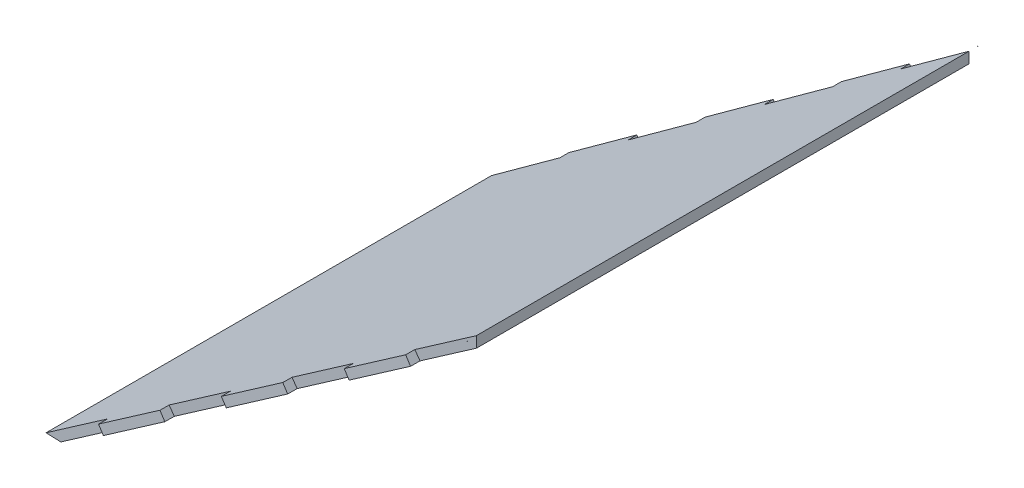
from build123d import *

# Parameters (mm, degrees)
CUT_EXTRUDE1_DEPTH = 878.515019104


with BuildPart() as part:
    # Boss-Extrude1: read off the stored shape, not the designer's step
    # Boss-Extrude1: loft between two sections, ruled curve by curve
    boss_extrude1_from = [
        Edge.make_line((-1299.235479685, 1493.906364056, 291.041413739), (-1816.691112906, 1125.851113248, 264.08415862)),
        Edge.make_line((-1816.691112906, 1125.851113248, 264.08415862), (-1816.691112906, 1125.851113248, -264.08415862)),
        Edge.make_line((-1299.235479685, 1493.906364056, 291.041413739), (-1299.235479685, 1493.906364056, -291.041413739)),
        Edge.make_line((-1299.235479685, 1493.906364056, -291.041413739), (-1816.691112906, 1125.851113248, -264.08415862)),
    ]
    boss_extrude1_to = [
        Edge.make_line((-1299.235479685, 1481.438435241, 291.041413739), (-1799.16222292, 1125.851113248, 264.997339826)),
        Edge.make_line((-1799.16222292, 1125.851113248, 264.997339826), (-1799.16222292, 1125.851113248, -264.997339826)),
        Edge.make_line((-1299.235479685, 1481.438435241, 291.041413739), (-1299.235479685, 1481.438435241, -291.041413739)),
        Edge.make_line((-1299.235479685, 1481.438435241, -291.041413739), (-1799.16222292, 1125.851113248, -264.997339826)),
    ]
    boss_extrude1 = Solid(Shell([*[Face.make_surface_from_curves(boss_extrude1_from[k], boss_extrude1_to[k]) for k in range(4)], Face(Wire(boss_extrude1_from)), Face(Wire(boss_extrude1_to))]))
    add(boss_extrude1)

    # Sketch2 → Cut-Extrude1 (cut, through all)
    with BuildSketch(Plane(origin=(-1142.087792172, 1605.682191448, 0), x_dir=(0.81489076097809, 0.5796145682024818, 0), z_dir=(-0.5796145682024818, 0.81489076097809, 0))):
        Polygon((-827.845096593, -264.08415862), (-827.414168646, -253.933301459), (-827.845096593, -253.915007546), align=None)
        Polygon((-737.192372014, -267.932581649), (-736.761444067, -257.781724488), (-827.414168646, -253.933301459), (-827.845096593, -264.08415862), align=None)
        Polygon((-555.886922855, -275.629427708), (-555.455994909, -265.478570547), (-646.108719488, -261.630147518), (-646.539647434, -271.781004679), align=None)
        Polygon((-374.581473697, -283.326273767), (-374.150545751, -273.175416606), (-464.80327033, -269.326993577), (-465.234198276, -279.477850738), align=None)
        Polygon((-193.276024539, -291.023119826), (-192.845096593, -280.872262665), (-283.497821172, -277.023839636), (-283.928749118, -287.174696797), align=None)
        Polygon((-192.845096593, -291.041413739), (-192.845096593, -280.872262665), (-193.276024539, -291.023119826), align=None)
        Polygon((-192.845096593, 280.872262665), (-193.276024539, 291.023119826), (-283.928749118, 287.174696797), (-283.497821172, 277.023839636), align=None)
        Polygon((-192.845096593, 280.872262665), (-192.845096593, 291.041413739), (-193.276024539, 291.023119826), align=None)
        Polygon((-374.150545751, 273.175416606), (-374.581473697, 283.326273767), (-465.234198276, 279.477850738), (-464.80327033, 269.326993577), align=None)
        Polygon((-555.455994909, 265.478570547), (-555.886922855, 275.629427708), (-646.539647434, 271.781004679), (-646.108719488, 261.630147518), align=None)
        Polygon((-736.761444067, 257.781724488), (-737.192372014, 267.932581649), (-827.845096593, 264.08415862), (-827.414168646, 253.933301459), align=None)
        Polygon((-827.414168646, 253.933301459), (-827.845096593, 264.08415862), (-827.845096593, 253.917668219), align=None)
        Polygon((-556.826174341, -297.75425795), (-555.886922855, -275.629427708), (-646.539647434, -271.781004679), (-647.47889892, -293.90583492), align=None)
        Polygon((-375.262063911, -299.358128032), (-374.581473697, -283.326273767), (-465.234198276, -279.477850738), (-465.91478849, -295.509705003), align=None)
        Polygon((-194.006069754, -308.219926744), (-193.276024539, -291.023119826), (-283.928749118, -287.174696797), (-284.658794333, -304.371503715), align=None)
        Polygon((-738.000757054, -286.974746688), (-737.192372014, -267.932581649), (-827.845096593, -264.08415862), (-828.653481633, -283.126323658), align=None)
        Polygon((-827.845096593, 264.08415862), (-737.192372014, 267.932581649), (-737.748395542, 281.030166657), (-828.401120121, 277.181743628), align=None)
        Polygon((-646.539647434, 271.781004679), (-555.886922855, 275.629427708), (-556.663676724, 293.926494848), (-647.316401303, 290.078071818), align=None)
        Polygon((-465.234198276, 279.477850738), (-374.581473697, 283.326273767), (-375.05432859, 294.464754124), (-465.707053169, 290.616331094), align=None)
        Polygon((-283.928749118, 287.174696797), (-193.276024539, 291.023119826), (-193.742299233, 302.006598264), (-284.395023812, 298.158175235), align=None)
    extrude(amount=-CUT_EXTRUDE1_DEPTH, mode=Mode.SUBTRACT)


with BuildPart() as cut_extrude1_piece_1:
    # of the separate pieces the step leaves, piece 1, a body of its own (cut_extrude1_pieces)
    add(part.part.solids().sort_by_distance((-1373.458706604, 1441.112952127, 287.174696797))[0])


with BuildPart() as cut_extrude1_piece_2:
    # of the separate pieces the step leaves, piece 2, a body of its own (cut_extrude1_pieces)
    add(part.part.solids().sort_by_distance((-1299.235479685, 1493.906364056, 291.041413739))[0])


with BuildPart() as cut_extrude1_piece_3:
    # of the separate pieces the step leaves, piece 3, a body of its own (cut_extrude1_pieces)
    add(part.part.solids().sort_by_distance((-1299.235479685, 1493.906364056, -291.041413739))[0])


solid = Compound([cut_extrude1_piece_1.part, cut_extrude1_piece_2.part, cut_extrude1_piece_3.part])
